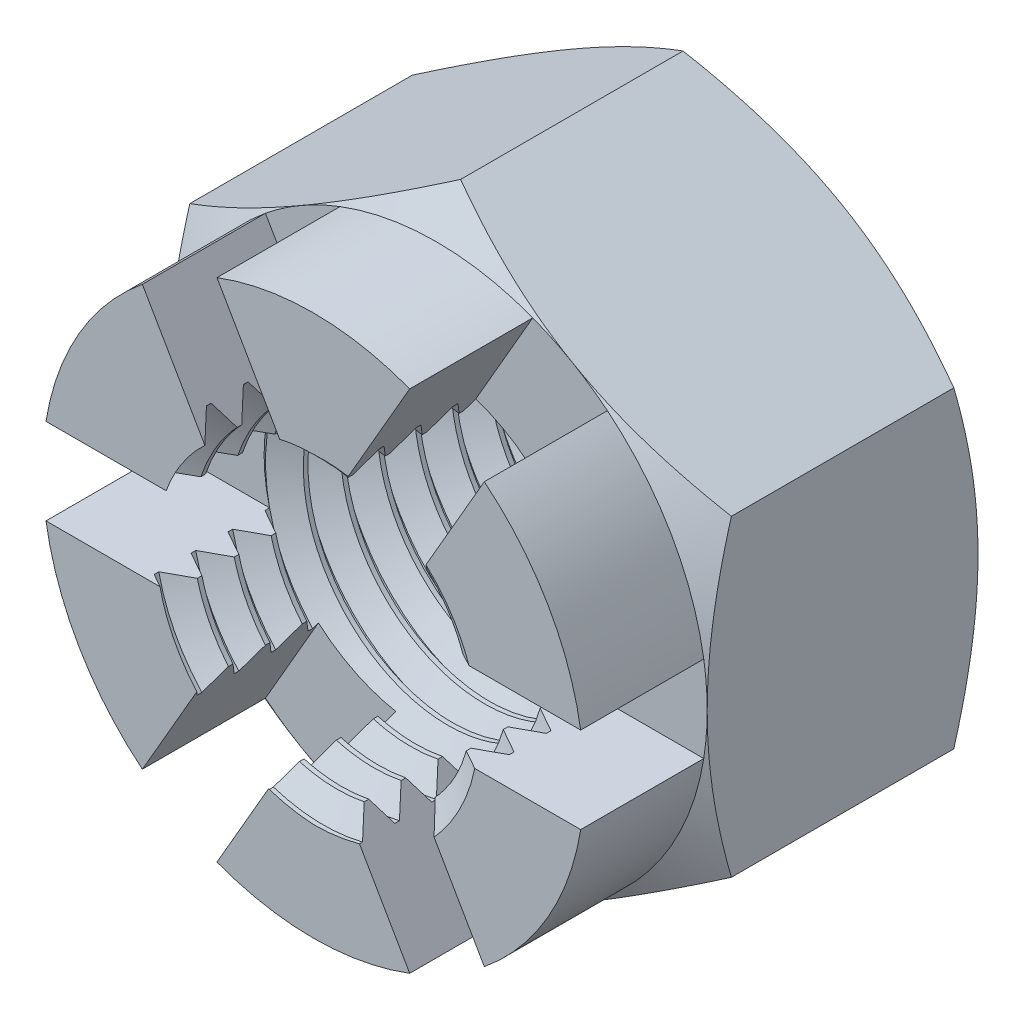
from build123d import *

# Parameters (mm, degrees)
EXTRUDE1_DEPTH      = 16
SKETCH3_OUTSIDE_W   = 115.282
SKETCH3_OUTSIDE_H   = 118.686
SKETCH3_OUTSIDE_R   = 11
CUT_EXTRUDE2_DEPTH  = 24.202011407
CUT_EXTRUDE2_DRAFT  = -60
SKETCH4_R           = 7
CUT_EXTRUDE3_DEPTH  = 24.202011407
CUT_EXTRUDE8_DEPTH  = 5
SKETCH14_OUTSIDE_W  = 104.478
SKETCH14_OUTSIDE_H  = 107.882
SKETCH14_OUTSIDE_R  = 11
CUT_EXTRUDE9_DEPTH  = 21.083160442
CUT_EXTRUDE9_DRAFT  = -60
SKETCH15_OUTSIDE_W  = 31.444
SKETCH15_OUTSIDE_H  = 34.848
SKETCH15_OUTSIDE_R  = 11
CUT_EXTRUDE10_DEPTH = 5
CIRPATTERN2_COUNT   = 6
SKETCH12_R          = 7
SKETCH12_R_2        = 6.025721421
EXTRUDE2_DEPTH      = 16
CUT_SWEEP1_PITCH    = 1.5
BOSS_EXTRUDE1_START = -0.1
SKETCH16_R          = 7.1
SKETCH16_R_2        = 7
BOSS_EXTRUDE1_DEPTH = 0.1
CUT_EXTRUDE11_DEPTH = 5
CIRPATTERN3_COUNT   = 6


with BuildPart() as part:
    # Sketch1 → Extrude1 (new body)
    with BuildSketch(Plane.XY):
        Polygon((0, 12.701705922), (-11, 6.350852961), (-11, -6.350852961), (0, -12.701705922), (11, -6.350852961), (11, 6.350852961), align=None)
    extrude(amount=-EXTRUDE1_DEPTH)


with BuildPart() as cut_extrude2_tool:
    # Sketch3 outside → Cut-Extrude2 (with draft: the straight prism first)
    with BuildSketch(Plane(origin=(0, 0, -16), x_dir=(-1, 0, 0), z_dir=(0, 0, -1))):
        Rectangle(SKETCH3_OUTSIDE_W, SKETCH3_OUTSIDE_H)
        Circle(SKETCH3_OUTSIDE_R, mode=Mode.SUBTRACT)
    extrude(amount=-CUT_EXTRUDE2_DEPTH)
    # Cut-Extrude2: the draft: its side faces are tilted about the plane it starts from
    cut_extrude2_sides = [cut_extrude2_tool.faces().sort_by_distance(p)[0] for p in [
        (0, -59.343, -3.898994296),
        (-57.641, 0, -3.898994296),
        (0, 59.343, -3.898994296),
        (57.641, 0, -3.898994296),
        (11, 0, -3.898994296),
    ]]
    draft(cut_extrude2_sides, Plane(origin=(0, 0, -16), x_dir=(-1, 0, 0), z_dir=(0, 0, -1)), CUT_EXTRUDE2_DRAFT)


with BuildPart() as part_1:
    add(part.part)

    # Cut-Extrude2: cut by cut_extrude2_tool
    add(cut_extrude2_tool.part, mode=Mode.SUBTRACT)

    # Sketch4 → Cut-Extrude3 (cut, through all)
    with BuildSketch(Plane.XY):
        Circle(SKETCH4_R)
    extrude(amount=-CUT_EXTRUDE3_DEPTH, mode=Mode.SUBTRACT)

    # Sketch13 → Cut-Extrude8 (cut)
    with BuildSketch(Plane.XY):
        Polygon((-1.515544457, 0.875), (1.515544457, -0.875), (7.015544457, 8.651279442), (3.984455543, 10.401279442), align=None)
    cut_extrude8 = extrude(amount=-CUT_EXTRUDE8_DEPTH, mode=Mode.SUBTRACT)


with BuildPart() as cut_extrude9_tool:
    # Sketch14 outside → Cut-Extrude9 (with draft: the straight prism first)
    with BuildSketch(Plane.XY.offset(-5)):
        Rectangle(SKETCH14_OUTSIDE_W, SKETCH14_OUTSIDE_H)
        Circle(SKETCH14_OUTSIDE_R, mode=Mode.SUBTRACT)
    extrude(amount=-CUT_EXTRUDE9_DEPTH)
    # Cut-Extrude9: the draft: its side faces are tilted about the plane it starts from
    cut_extrude9_sides = [cut_extrude9_tool.faces().sort_by_distance(p)[0] for p in [
        (0, -53.941, -15.541580221),
        (52.239, 0, -15.541580221),
        (0, 53.941, -15.541580221),
        (-52.239, 0, -15.541580221),
        (-11, 0, -15.541580221),
    ]]
    draft(cut_extrude9_sides, Plane.XY.offset(-5), CUT_EXTRUDE9_DRAFT)


with BuildPart() as part_2:
    add(part_1.part)

    # Cut-Extrude9: cut by cut_extrude9_tool
    add(cut_extrude9_tool.part, mode=Mode.SUBTRACT)

    # Sketch15 outside → Cut-Extrude10 (cut)
    with BuildSketch(Plane.XY):
        Rectangle(SKETCH15_OUTSIDE_W, SKETCH15_OUTSIDE_H)
        Circle(SKETCH15_OUTSIDE_R, mode=Mode.SUBTRACT)
    extrude(amount=-CUT_EXTRUDE10_DEPTH, mode=Mode.SUBTRACT)

    # CirPattern2: Cut-Extrude8 ×6 about axis
    cirpattern2_axis = Axis((0, 0, 0), (0, 0, 1))
    for i in range(1, CIRPATTERN2_COUNT):
        add(cut_extrude8.rotate(cirpattern2_axis, i * 360 / CIRPATTERN2_COUNT), mode=Mode.SUBTRACT)



with BuildPart() as body_2:
    # Sketch12 → Extrude2 (new body)
    with BuildSketch(Plane.XY):
        Circle(SKETCH12_R)
        Circle(SKETCH12_R_2, mode=Mode.SUBTRACT)
    extrude(amount=-EXTRUDE2_DEPTH)

    # Cut-Sweep1: arcs per turn and ends read off the stored shape
    # Cut-Sweep1: the profile of Sketch9 profile screwed along a right-hand helix through 13 turns, 6 arcs to a turn; built about Z, then put on its axis
    cut_sweep1_z = Axis((0, 0, 0), (0, 0, 1))
    cut_sweep1_corners = [(7.0003, 0, -2.249826795), (7.0003, 0, -2.062673205), (6.025721421, 0, -1.5), (6.025721421, 0, -2.8125)]
    with BuildLine(mode=Mode.PRIVATE) as cut_sweep1_profile:
        Line(cut_sweep1_corners[0], cut_sweep1_corners[1])
        Line(cut_sweep1_corners[1], cut_sweep1_corners[2])
        Line(cut_sweep1_corners[2], cut_sweep1_corners[3])
        Line(cut_sweep1_corners[3], cut_sweep1_corners[0])
    cut_sweep1_cap = Face(cut_sweep1_profile.wire())
    cut_sweep1_turn_angles = [0, 30, 60, 90, 120, 150, 180, 210, 240, 270, 300, 330, 360]
    cut_sweep1_turn_weights = [1, 0.8660254037844387, 1, 0.8660254037844387, 1, 0.8660254037844387, 1, 0.8660254037844387, 1, 0.8660254037844387, 1, 0.8660254037844387, 1]
    cut_sweep1_turn_rails = [Edge.make_bspline([Vector(p[0], p[1], 0).rotate(cut_sweep1_z, cut_sweep1_turn_angles[k]) / cut_sweep1_turn_weights[k] + Vector(0, 0, p[2] + CUT_SWEEP1_PITCH * cut_sweep1_turn_angles[k] / 360) for k in range(13)], [0, 0, 0, 1, 1, 2, 2, 3, 3, 4, 4, 5, 5, 6, 6, 6], 2, cut_sweep1_turn_weights) for p in cut_sweep1_corners]
    cut_sweep1_turn_sides = [Face.make_surface_from_curves(cut_sweep1_turn_rails[p[0]], cut_sweep1_turn_rails[p[1]]) for p in [(0, 1), (1, 2), (2, 3), (3, 0)]]
    cut_sweep1 = Plane(origin=(0, 0, 0), x_dir=(0, 1, 0), z_dir=(0, 0, -1)) * Solid(Shell([*[p.moved(Location((0, 0, CUT_SWEEP1_PITCH * i))) for i in range(13) for p in cut_sweep1_turn_sides], cut_sweep1_cap, cut_sweep1_cap.rotate(cut_sweep1_z, 4680).moved(Location((0, 0, CUT_SWEEP1_PITCH * 4680 / 360)))]))
    add(cut_sweep1, mode=Mode.SUBTRACT)


with BuildPart() as part_3:
    add(part_2.part)

    add(body_2.part)  # Boss-Extrude1 merges body 2
    # Sketch16 → Boss-Extrude1 (add)
    with BuildSketch(Plane(origin=(0, 0, -16), x_dir=(-1, 0, 0), z_dir=(0, 0, -1)).offset(BOSS_EXTRUDE1_START)):
        Circle(SKETCH16_R)
        Circle(SKETCH16_R_2, mode=Mode.SUBTRACT)
    extrude(amount=BOSS_EXTRUDE1_DEPTH)

    # Sketch17 → Cut-Extrude11 (cut)
    with BuildSketch(Plane.XY):
        Polygon((-1.515544457, 0.875), (1.515544457, -0.875), (7.015544457, 8.651279442), (3.984455543, 10.401279442), align=None)
    cut_extrude11 = extrude(amount=-CUT_EXTRUDE11_DEPTH, mode=Mode.SUBTRACT)

    # CirPattern3: Cut-Extrude11 ×6 about axis
    cirpattern3_axis = Axis((0, 0, -35.798989873), (0, 0, 1))
    for i in range(1, CIRPATTERN3_COUNT):
        add(cut_extrude11.rotate(cirpattern3_axis, i * 360 / CIRPATTERN3_COUNT), mode=Mode.SUBTRACT)


solid = part_3.part
